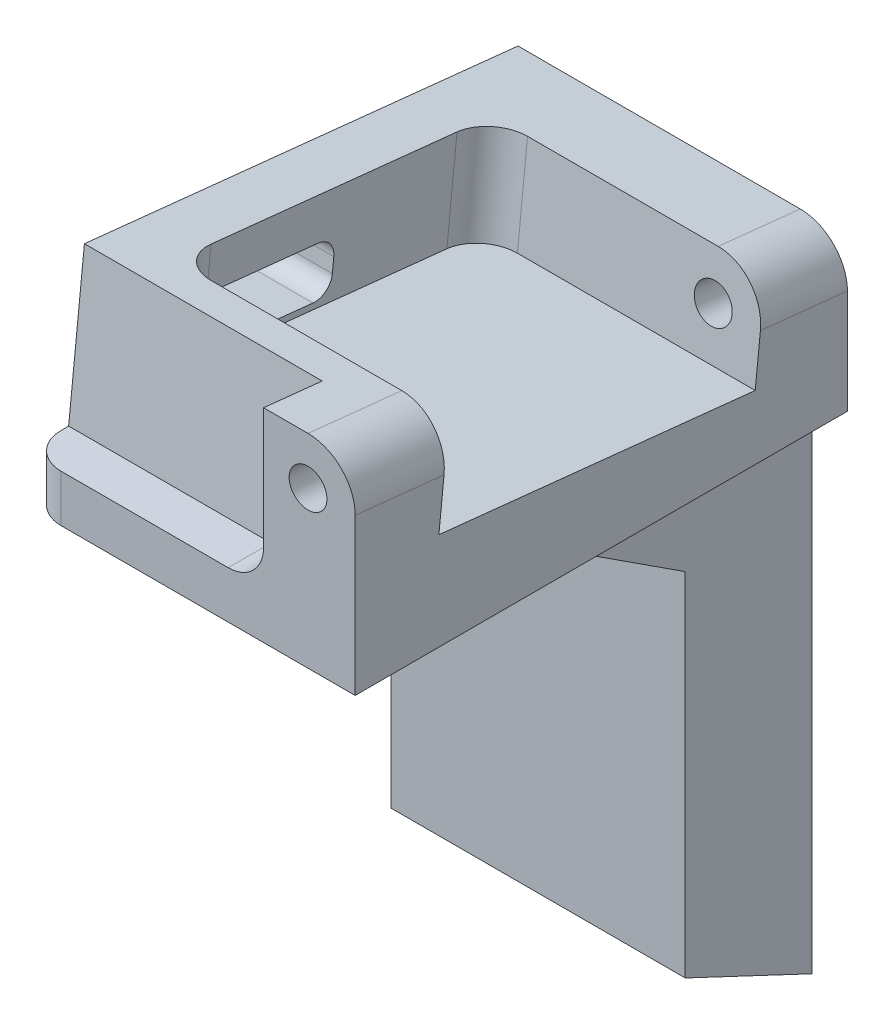
from build123d import *

# Parameters (mm, degrees)
EXTRUDE_START         = -12.47
EXTRUDE_1_DEPTH       = 23.94
EXTRUDE_START_2       = -42.420417041
EXTRUDE_3_DEPTH       = 42.420417041
EXTRUDE_START_3       = 135
EXTRUDE_3_2_OUTLINE_W = 5.53
EXTRUDE_3_2_OUTLINE_H = 12
EXTRUDE_3_2_DEPTH     = 1
EXTRUDE_START_4       = 92.811966442
EXTRUDE_3_3_OUTLINE_W = 5.53
EXTRUDE_3_3_OUTLINE_H = 12
EXTRUDE_3_3_DEPTH     = 0.418113953
SKETCH_3_W            = 8.92360814
SKETCH_3_H            = 8.098758973
CUT_EXTRUDE_1_DEPTH   = 24.94
EXTRUDE_4_DEPTH       = 4
EXTRUDE_5_DEPTH       = 1
FILLET_1_R            = 3
CUT_EXTRUDE_START     = -12.47
CUT_EXTRUDE_4_DEPTH   = 20.17
CUT_EXTRUDE_START_2   = 130.027390523
CUT_EXTRUDE_4_2_DEPTH = 4.972609477
CUT_EXTRUDE_5_REACH   = 78.971
SKETCH_6_R            = 1.6
CUT_EXTRUDE_6_DEPTH   = 8.2
CUT_EXTRUDE_8_DEPTH   = 10


with BuildPart() as part:
    # 草图1 → 凸台-拉伸1 (new body)
    with BuildSketch(Plane(origin=(0, 0, 0), x_dir=(0, 0, -1), z_dir=(1, 0, 0)).offset(EXTRUDE_START)):
        Polygon((-135, 224), (-135, 206.75), (-116.178095192, 206.75), (-104.005, 198.85), (-104.005, 168.99910251), (-93.25, 163.930391323), (-93.25, 219.611898178), align=None)
    extrude(amount=EXTRUDE_1_DEPTH)

    # 凸台-拉伸3: read off the stored shape, not the designer's step
    # 凸台-拉伸3 outline → 凸台-拉伸3 (add)
    with BuildSketch(Plane(origin=(11.47, 224, 135), x_dir=(1, 0, 0), z_dir=(0, 0.10452846326765014, 0.9945218953682736)).offset(EXTRUDE_START_2)):
        with BuildLine():
            Line((0, 0), (0, -4))
            Line((0, -4), (4, -4))
            ThreePointArc((4, -4), (2.828427125, -1.171572875), (0, 0))
        make_face()
    extrude(amount=EXTRUDE_3_DEPTH)

    # Extrude 3 2 outline → Extrude 3 2 (cut)
    with BuildSketch(Plane.XY.offset(EXTRUDE_START_3)):
        with Locations((14.235, 220)):
            Rectangle(EXTRUDE_3_2_OUTLINE_W, EXTRUDE_3_2_OUTLINE_H)
    extrude(amount=EXTRUDE_3_2_DEPTH, mode=Mode.SUBTRACT)

    # Extrude 3 3 outline → Extrude 3 3 (cut)
    with BuildSketch(Plane.XY.offset(EXTRUDE_START_4)):
        with Locations((14.235, 220)):
            Rectangle(EXTRUDE_3_3_OUTLINE_W, EXTRUDE_3_3_OUTLINE_H)
    extrude(amount=EXTRUDE_3_3_DEPTH, mode=Mode.SUBTRACT)

    # 草图3 → 切除-拉伸1 (cut)
    with BuildSketch(Plane(origin=(0, 0, 93.25), x_dir=(-1, 0, 0), z_dir=(0, 0, -1))):
        with Locations((-14.443820209, 216.390986059)):
            Rectangle(SKETCH_3_W, SKETCH_3_H)
    extrude(amount=CUT_EXTRUDE_1_DEPTH, mode=Mode.SUBTRACT)

    # 草图4 → 凸台-拉伸4 (add)
    with BuildSketch(Plane(origin=(11.47, 0, 0), x_dir=(0, 0, -1), z_dir=(1, 0, 0))):
        Polygon((-93.25, 206.75), (-93.25, 215.589865059), (-135, 219.977966882), (-135, 206.75), align=None)
    extrude(amount=EXTRUDE_4_DEPTH)

    # 草图10 → 凸台-拉伸5 (add)
    with BuildSketch(Plane(origin=(11.47, 0, 0), x_dir=(0, 0, -1), z_dir=(1, 0, 0))):
        Polygon((-93.25, 163.930391323), (-104.005, 168.99910251), (-104.005, 198.85), (-116.178095192, 206.75), (-93.25, 206.75), align=None)
    extrude(amount=EXTRUDE_5_DEPTH)

    # 圆角1
    fillet_1_edges = [part.edges().sort_by_distance(p)[0] for p in [
        (-12.47, 215.375, 135),
    ]]
    fillet(fillet_1_edges, radius=FILLET_1_R)

    # 切除-拉伸4: read off the stored shape, not the designer's step
    # 切除-拉伸4 outline → 切除-拉伸4 (cut)
    with BuildSketch(Plane.YZ.offset(CUT_EXTRUDE_START)):
        Polygon((210.75, 131.365089719), (223.477357684, 130.027390523), (224, 135), (210.75, 135), align=None)
    extrude(amount=CUT_EXTRUDE_4_DEPTH, mode=Mode.SUBTRACT)

    # Cut-Extrude 4 2 outline → Cut-Extrude 4 2 (add)
    with BuildSketch(Plane.XY.offset(CUT_EXTRUDE_START_2)):
        with BuildLine():
            ThreePointArc((7.7, 213.75), (6.821320344, 211.628679656), (4.7, 210.75))
            Line((4.7, 210.75), (7.7, 210.75))
            Line((7.7, 210.75), (7.7, 213.75))
        make_face()
    extrude(amount=CUT_EXTRUDE_4_2_DEPTH)

    # 切除-拉伸5: up to this plane
    cut_extrude_5_end = Plane(origin=(11.47, 219.611898178, 93.25), z_dir=(0, 0, 1))
    # 草图6 → 切除-拉伸5 (cut, up to the surface)
    with BuildSketch(Plane(origin=(11.47, 224, 135), x_dir=(1, 0, 0), z_dir=(0, 0.10452846326765014, 0.9945218953682736)), mode=Mode.PRIVATE) as cut_extrude_5_sk1:
        with Locations(Location((0, -4, 0), (0, 0, 90))):
            Circle(SKETCH_6_R)
    cut_extrude_5_tool1 = split(extrude(cut_extrude_5_sk1.sketch, amount=-CUT_EXTRUDE_5_REACH, mode=Mode.PRIVATE), bisect_by=cut_extrude_5_end, keep=Keep.BOTH, mode=Mode.PRIVATE)
    add(cut_extrude_5_tool1.solids().sort_by_distance((11.47, 220.021912, 135.418114))[0], mode=Mode.SUBTRACT)

    # 草图7 → 切除-拉伸6 (cut)
    with BuildSketch(Plane(origin=(0, 207.518492152, -21.811072421), x_dir=(1, 0, 0), z_dir=(0, 0.9945218953682738, -0.10452846326765014))):
        with BuildLine():
            Line((15.47, -149.674831647), (15.47, -122.694860975))
            Line((15.47, -122.694860975), (-4.7, -122.694860975))
            ThreePointArc((-4.7, -122.694860975), (-6.821320344, -123.573540631), (-7.7, -125.694860975))
            Line((-7.7, -125.694860975), (-7.7, -146.674831647))
            ThreePointArc((-7.7, -146.674831647), (-6.821320344, -148.79615199), (-4.7, -149.674831647))
            Line((-4.7, -149.674831647), (15.47, -149.674831647))
        make_face()
    extrude(amount=-CUT_EXTRUDE_6_DEPTH, mode=Mode.SUBTRACT)

    # 草图9 → 切除-拉伸8 (cut)
    with BuildSketch(Plane.ZY.offset(12.47)):
        with BuildLine():
            Line((122.934325929, 219.212567575), (114.978150766, 218.376339869))
            ThreePointArc((114.978150766, 218.376339869), (113.969224519, 217.828537613), (113.643160618, 216.727764331))
            Line((113.643160618, 216.727764331), (113.768594774, 215.534338057))
            ThreePointArc((113.768594774, 215.534338057), (114.316397031, 214.52541181), (115.417170312, 214.199347909))
            Line((115.417170312, 214.199347909), (123.373345475, 215.035575615))
            ThreePointArc((123.373345475, 215.035575615), (124.382271722, 215.583377871), (124.708335623, 216.684151153))
            Line((124.708335623, 216.684151153), (124.582901467, 217.877577427))
            ThreePointArc((124.582901467, 217.877577427), (124.035099211, 218.886503674), (122.934325929, 219.212567575))
        make_face()
    extrude(amount=-CUT_EXTRUDE_8_DEPTH, mode=Mode.SUBTRACT)


solid = part.part
